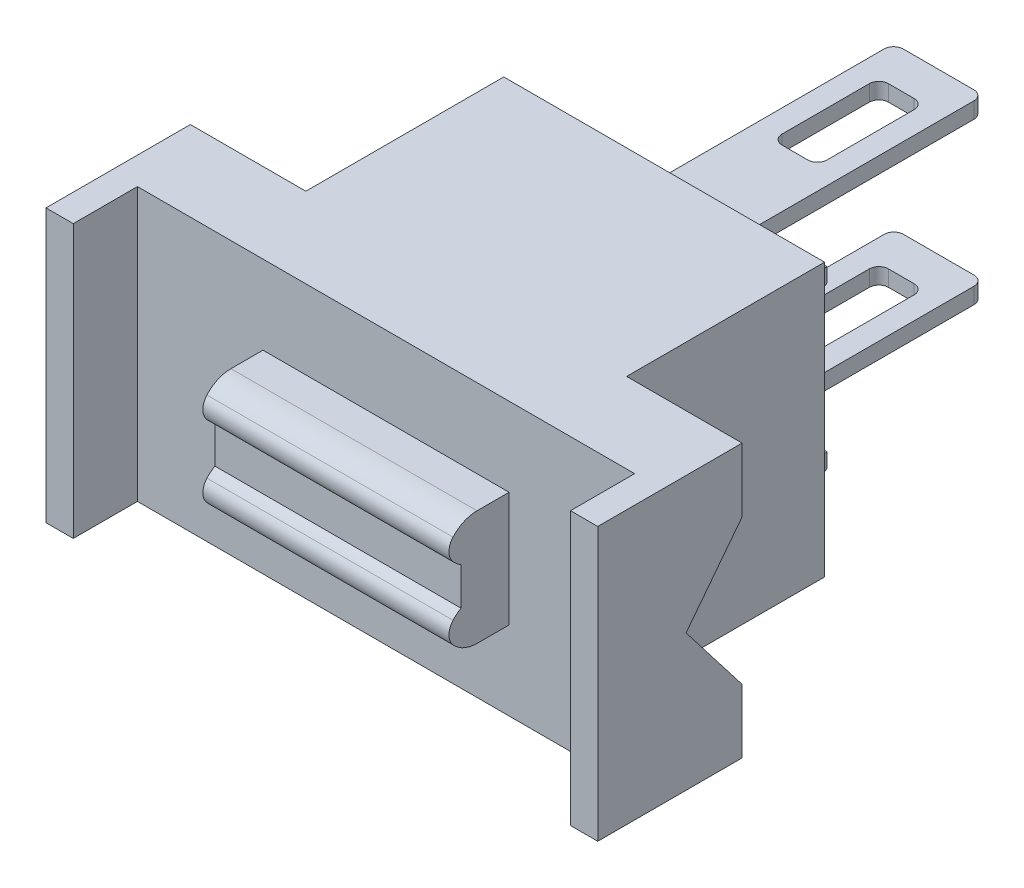
from build123d import *

# Parameters (mm, degrees)
SKETCH1_W           = 10
SKETCH1_H           = 8.5
BOSS_EXTRUDE1_DEPTH = 10.67
SKETCH2_W           = 7.4
SKETCH2_H           = 0.5
BOSS_EXTRUDE2_DEPTH = 1.5
SKETCH3_W           = 2.8
SKETCH3_H           = 0.5
BOSS_EXTRUDE3_DEPTH = 7.06
FILLET4_R           = 0.1
SKETCH5_W           = 4.5
SKETCH5_H           = 8.5
BOSS_EXTRUDE4_DEPTH = 3.6
SKETCH6_W           = 4.5
SKETCH6_H           = 8.5
BOSS_EXTRUDE5_DEPTH = 3.6
CUT_EXTRUDE2_START  = -17.2
CUT_EXTRUDE2_DEPTH  = 17.2
BOSS_EXTRUDE6_DEPTH = 10
SKETCH9_W           = 15.5
SKETCH9_H           = 8.5
CUT_EXTRUDE3_DEPTH  = 2
SKETCH10_W          = 7.671768302
SKETCH10_H          = 3.58137051
BOSS_EXTRUDE7_DEPTH = 2
SKETCH12_W          = 7.671768302
SKETCH12_H          = 1.176323548
CUT_EXTRUDE4_DEPTH  = 0.5
FILLET7_R           = 1
FILLET8_R           = 0.5
SKETCH13_W          = 1.4
SKETCH13_H          = 3.317554906
CUT_EXTRUDE5_DEPTH  = 10
FILLET9_R           = 0.3


with BuildPart() as part:
    # Sketch1 → Boss-Extrude1 (new body)
    with BuildSketch(Plane.XY):
        Rectangle(SKETCH1_W, SKETCH1_H)
    extrude(amount=BOSS_EXTRUDE1_DEPTH)

    # Sketch2 → Boss-Extrude2 (add)
    with BuildSketch(Plane(origin=(0, 0, 0), x_dir=(-1, 0, 0), z_dir=(0, 0, -1))):
        with Locations((0.121950207, -2.578749491)):
            Rectangle(SKETCH2_W, SKETCH2_H)
        with Locations((0.121950207, 2.421250509)):
            Rectangle(SKETCH2_W, SKETCH2_H)
    extrude(amount=BOSS_EXTRUDE2_DEPTH)

    # Sketch3 → Boss-Extrude3 (add)
    with BuildSketch(Plane(origin=(0, 0, -1.5), x_dir=(-1, 0, 0), z_dir=(0, 0, -1))):
        with Locations((0, -2.578749491)):
            Rectangle(SKETCH3_W, SKETCH3_H)
        with Locations((0.006424345, 2.421250509)):
            Rectangle(SKETCH3_W, SKETCH3_H)
    extrude(amount=BOSS_EXTRUDE3_DEPTH)

    # Fillet4
    fillet4_edges = [part.edges().sort_by_distance(p)[0] for p in [
        (2.489024896, -2.828749491, -1.5),
        (-2.610975104, -2.328749491, -1.5),
        (-2.614187276, 2.671250509, -1.5),
        (2.485812724, 2.171250509, -1.5),
    ]]
    fillet(fillet4_edges, radius=FILLET4_R)

    # Sketch5 → Boss-Extrude4 (add)
    with BuildSketch(Plane(origin=(5, 0, 0), x_dir=(0, 0, -1), z_dir=(1, 0, 0))):
        with Locations((-8.42, 0)):
            Rectangle(SKETCH5_W, SKETCH5_H)
    extrude(amount=BOSS_EXTRUDE4_DEPTH)

    # Sketch6 → Boss-Extrude5 (add)
    with BuildSketch(Plane.ZY.offset(5)):
        with Locations((8.42, 0)):
            Rectangle(SKETCH6_W, SKETCH6_H)
    extrude(amount=BOSS_EXTRUDE5_DEPTH)

    # Sketch7 → Cut-Extrude2 (cut)
    with BuildSketch(Plane(origin=(8.6, 0, 0), x_dir=(0, 0, -1), z_dir=(1, 0, 0)).offset(CUT_EXTRUDE2_START)):
        Polygon((-6.17, 2.257266115), (-7.916888321, -4.993e-06), (-6.17, -2.262882433), align=None)
    cut_extrude2 = extrude(amount=CUT_EXTRUDE2_DEPTH, mode=Mode.SUBTRACT)

    # Mirror2: Cut-Extrude2 across plane
    add(cut_extrude2.mirror(Plane(origin=(0, 0, 0), x_dir=(0, 0, 1), z_dir=(1, 0, 0))), mode=Mode.SUBTRACT)

    # Sketch8 → Boss-Extrude6 (add)
    with BuildSketch(Plane(origin=(5, 0, 0), x_dir=(0, 0, -1), z_dir=(1, 0, 0))):
        Polygon((-6.17, -2.262882433), (-7.916892176, 0), (-6.17, 2.257266115), align=None)
    extrude(amount=-BOSS_EXTRUDE6_DEPTH)

    # Sketch9 → Cut-Extrude3 (cut)
    with BuildSketch(Plane.XY.offset(10.67)):
        Rectangle(SKETCH9_W, SKETCH9_H)
    extrude(amount=-CUT_EXTRUDE3_DEPTH, mode=Mode.SUBTRACT)

    # Sketch10 → Boss-Extrude7 (add)
    with BuildSketch(Plane.XY.offset(8.67)):
        Rectangle(SKETCH10_W, SKETCH10_H)
    extrude(amount=BOSS_EXTRUDE7_DEPTH)

    # Sketch12 → Cut-Extrude4 (cut)
    with BuildSketch(Plane.XY.offset(10.67)):
        Rectangle(SKETCH12_W, SKETCH12_H)
    extrude(amount=-CUT_EXTRUDE4_DEPTH, mode=Mode.SUBTRACT)

    # Fillet7
    # the kernel refuses this fillet: 1 mm, written as the material it takes off along each edge
    with BuildSketch(Plane(origin=(6.00094766, 0.588161774, 10.67), x_dir=(0, 1, 0), z_dir=(-1, 0, 0))) as fillet7_piece_1:
        with BuildLine():
            CenterArc((0.866025404, 1), FILLET7_R, 210, 60)
            Line((0, 0.5), (-0.017320508, 0.49))
            ThreePointArc((-0.017320508, 0.49), (-0.02, 0.25), (-0.02, 0))
            Line((-0.02, 0), (0, -0.02))
            Line((0, -0.02), (0.866025404, -0.02))
            Line((0.866025404, -0.02), (0.866025404, 0))
        make_face()
    extrude(amount=12.001895321, mode=Mode.SUBTRACT)
    with BuildSketch(Plane(origin=(-6.00094766, -0.588161774, 10.67), x_dir=(0, 0, -1), z_dir=(1, 0, 0))) as fillet7_piece_2:
        with BuildLine():
            CenterArc((1, -0.866025404), FILLET7_R, 120, 60)
            Line((0, -0.866025404), (-0.02, -0.866025404))
            Line((-0.02, -0.866025404), (-0.02, 0))
            Line((-0.02, 0), (0, 0.02))
            ThreePointArc((0, 0.02), (0.25, 0.02), (0.49, 0.017320508))
            Line((0.49, 0.017320508), (0.5, 0))
        make_face()
    extrude(amount=12.001895321, mode=Mode.SUBTRACT)
    with BuildSketch(Plane(origin=(6.335884151, -1.790685255, 10.67), x_dir=(0, 0, -1), z_dir=(-1, 0, 0)), Plane(origin=(-6.335884151, 1.790685255, 10.67), x_dir=(0, 0, -1), z_dir=(1, 0, 0))) as fillet7_piece_3:
        with BuildLine():
            CenterArc((FILLET7_R, -FILLET7_R), FILLET7_R, 90, 90)
            Line((0, -FILLET7_R), (-FILLET7_R * 0.02, -FILLET7_R))
            Line((-FILLET7_R * 0.02, -FILLET7_R), (-FILLET7_R * 0.02, FILLET7_R * 0.02))
            Line((-FILLET7_R * 0.02, FILLET7_R * 0.02), (FILLET7_R, FILLET7_R * 0.02))
            Line((FILLET7_R, FILLET7_R * 0.02), (FILLET7_R, 0))
        make_face()
    extrude(amount=12.671768302, mode=Mode.SUBTRACT)

    # Fillet8
    fillet8_edges = [part.edges().sort_by_distance(p)[0] for p in [
        (0, 1.122436216, 10.613367002),
        (0, -1.122436216, 10.613367002),
    ]]
    fillet(fillet8_edges, radius=FILLET8_R)

    # Sketch13 → Cut-Extrude5 (cut)
    with BuildSketch(Plane(origin=(0, 2.671250509, 0), x_dir=(1, 0, 0), z_dir=(0, 1, 0))):
        with Locations((0, 5.735027383)):
            Rectangle(SKETCH13_W, SKETCH13_H)
    extrude(amount=-CUT_EXTRUDE5_DEPTH, mode=Mode.SUBTRACT)

    # Fillet9
    fillet9_edges = [part.edges().sort_by_distance(p)[0] for p in [
        (0.7, -2.578749491, -7.393804836),
        (0.7, 2.421250509, -7.393804836),
        (0.7, -2.578749491, -4.07624993),
        (0.7, 2.421250509, -4.07624993),
        (-0.7, -2.578749491, -4.07624993),
        (-0.7, 2.421250509, -4.07624993),
        (-0.7, -2.578749491, -7.393804836),
        (-0.7, 2.421250509, -7.393804836),
        (1.4, -2.578749491, -8.56),
        (-1.4, -2.578749491, -8.56),
        (1.393575655, 2.421250509, -8.56),
        (-1.406424345, 2.421250509, -8.56),
    ]]
    fillet(fillet9_edges, radius=FILLET9_R)


solid = part.part
